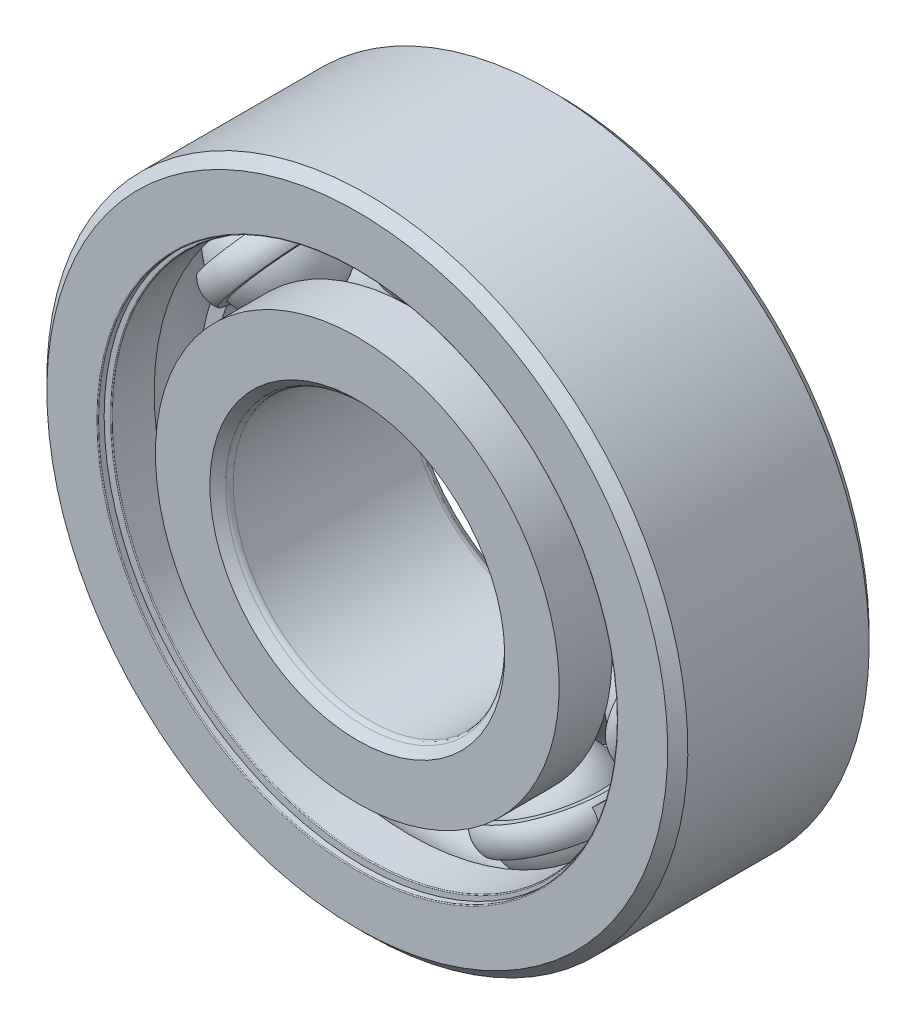
from build123d import *

# Parameters (mm, degrees)
BOSS_EXTRUDE1_DEPTH = 0.916666667
CIRPATTERN1_COUNT   = 7
CIRPATTERN2_COUNT   = 7
FILLET1_R           = 0.0495
FILLET2_R           = 0.4125


with BuildPart() as part:
    # Sketch3 → Revolve1 (revolve)
    with BuildSketch(Plane(origin=(0, 0, 0), x_dir=(0, 0, -1), z_dir=(1, 0, 0))):
        with BuildLine():
            Line((4.95, 17.5), (5.5, 16.95))
            Line((5.5, 16.95), (5.5, 13.976923077))
            Line((5.5, 13.976923077), (2.6125, 13.976923077))
            ThreePointArc((2.6125, 13.976923077), (0, 15.501076145), (-2.6125, 13.976923077))
            Line((-2.6125, 13.976923077), (-5.5, 13.976923077))
            Line((-5.5, 13.976923077), (-5.5, 16.95))
            Line((-5.5, 16.95), (-4.95, 17.5))
            Line((-4.95, 17.5), (4.95, 17.5))
        make_face()
    revolve(axis=Axis((0, 0, 5.5), (0, 0, -1)))

    # Sketch8 → Cut-Revolve1 (revolve, cut)
    with BuildSketch(Plane(origin=(0, 0, 0), x_dir=(0, 0, -1), z_dir=(1, 0, 0))):
        Polygon((-5.148, 13.976923077), (-4.95, 13.976923077), (-4.95, 15.151282051), (-5.148, 15.151282051), (-5.148, 14.174923077), (-5.5, 14.174923077), (-5.5, 13.976923077), align=None)
        Polygon((4.95, 13.976923077), (5.148, 13.976923077), (5.5, 13.976923077), (5.5, 14.174923077), (5.148, 14.174923077), (5.148, 15.151282051), (4.95, 15.151282051), align=None)
    revolve(axis=Axis((0, 0, 5.5), (0, 0, -1)), mode=Mode.SUBTRACT)

    # Fillet1
    fillet1_edges = [part.edges().sort_by_distance(p)[0] for p in [
        (0, -13.976923077, -4.95),
        (0, -14.174923077, -5.5),
        (0, -13.976923077, 4.95),
        (0, -14.174923077, 5.5),
    ]]
    fillet(fillet1_edges, radius=FILLET1_R)


with BuildPart() as body_2:
    # Sketch4 → Revolve2 (revolve)
    with BuildSketch(Plane(origin=(0, 0, 0), x_dir=(0, 0, -1), z_dir=(1, 0, 0))):
        with BuildLine():
            Line((-4.95, 7.5), (-5.5, 8.05))
            Line((-5.5, 8.05), (-5.5, 11.023076923))
            Line((-5.5, 11.023076923), (-2.6125, 11.023076923))
            ThreePointArc((-2.6125, 11.023076923), (0, 9.498923855), (2.6125, 11.023076923))
            Line((2.6125, 11.023076923), (5.5, 11.023076923))
            Line((5.5, 11.023076923), (5.5, 8.05))
            Line((5.5, 8.05), (4.95, 7.5))
            Line((4.95, 7.5), (-4.95, 7.5))
        make_face()
    revolve(axis=Axis((0, 0, 5.5), (0, 0, -1)))

    # Fillet2
    fillet2_edges = [body_2.edges().sort_by_distance(p)[0] for p in [
        (0, -7.5, -4.95),
        (0, -7.5, 4.95),
    ]]
    fillet(fillet2_edges, radius=FILLET2_R)


with BuildPart() as body_3:
    # Sketch5 → Revolve3 (revolve)
    with BuildSketch(Plane(origin=(0, 0, 0), x_dir=(0, 0, -1), z_dir=(1, 0, 0))):
        with BuildLine():
            Line((-3.001076145, 12.5), (3.001076145, 12.5))
            ThreePointArc((3.001076145, 12.5), (0, 15.501076145), (-3.001076145, 12.5))
        make_face()
    revolve(axis=Axis((0, 12.5, 3.001076145), (0, 0, -1)))


with BuildPart() as body_4:
    # Sketch6 → Revolve4 (revolve)
    with BuildSketch(Plane(origin=(0, 0, 0), x_dir=(0, 0, -1), z_dir=(1, 0, 0))):
        with BuildLine():
            Line((-2.908802603, 13.238461538), (-3.340668836, 13.238461538))
            ThreePointArc((-3.340668836, 13.238461538), (-3.556601952, 12.5), (-3.340668836, 11.761538462))
            Line((-3.340668836, 11.761538462), (-2.908802603, 11.761538462))
            ThreePointArc((-2.908802603, 11.761538462), (-3.001076145, 12.5), (-2.908802603, 13.238461538))
        make_face()
    revolve4 = revolve(axis=Axis((0, 17.5, 0), (0, -1, 0)))

    # Sketch7 → Boss-Extrude1 (add, symmetric)
    with BuildSketch(Plane.XY):
        with BuildLine():
            Line((9.772893531, 7.793622523), (10.35024601, 8.254045762))
            ThreePointArc((10.35024601, 8.254045762), (5.743953192, 11.927441705), (0, 13.238461538))
            Line((0, 13.238461538), (0, 12.5))
            ThreePointArc((0, 12.5), (5.423546739, 11.262110849), (9.772893531, 7.793622523))
        make_face()
    boss_extrude1 = extrude(amount=BOSS_EXTRUDE1_DEPTH, both=True)

    # CirPattern2: Revolve4, Boss-Extrude1 ×7 about axis
    cirpattern2_axis = Axis((0, 0, 5.5), (0, 0, -1))
    add([revolve4.rotate(cirpattern2_axis, i * 360 / CIRPATTERN2_COUNT) for i in range(1, CIRPATTERN2_COUNT)])
    add([boss_extrude1.rotate(cirpattern2_axis, i * 360 / CIRPATTERN2_COUNT) for i in range(1, CIRPATTERN2_COUNT)])


with BuildPart() as cirpattern1_1:
    # CirPattern1: pattern copy
    add(body_3.part.rotate(Axis((0, 0, 5.5), (0, 0, -1)), 1 * 360 / CIRPATTERN1_COUNT))


with BuildPart() as cirpattern1_2:
    # CirPattern1: pattern copy
    add(body_3.part.rotate(Axis((0, 0, 5.5), (0, 0, -1)), 2 * 360 / CIRPATTERN1_COUNT))


with BuildPart() as cirpattern1_3:
    # CirPattern1: pattern copy
    add(body_3.part.rotate(Axis((0, 0, 5.5), (0, 0, -1)), 3 * 360 / CIRPATTERN1_COUNT))


with BuildPart() as cirpattern1_4:
    # CirPattern1: pattern copy
    add(body_3.part.rotate(Axis((0, 0, 5.5), (0, 0, -1)), 4 * 360 / CIRPATTERN1_COUNT))


with BuildPart() as cirpattern1_5:
    # CirPattern1: pattern copy
    add(body_3.part.rotate(Axis((0, 0, 5.5), (0, 0, -1)), 5 * 360 / CIRPATTERN1_COUNT))


with BuildPart() as cirpattern1_6:
    # CirPattern1: pattern copy
    add(body_3.part.rotate(Axis((0, 0, 5.5), (0, 0, -1)), 6 * 360 / CIRPATTERN1_COUNT))


solid = Compound([part.part, body_2.part, body_3.part, body_4.part, cirpattern1_1.part, cirpattern1_2.part, cirpattern1_3.part, cirpattern1_4.part, cirpattern1_5.part, cirpattern1_6.part])
